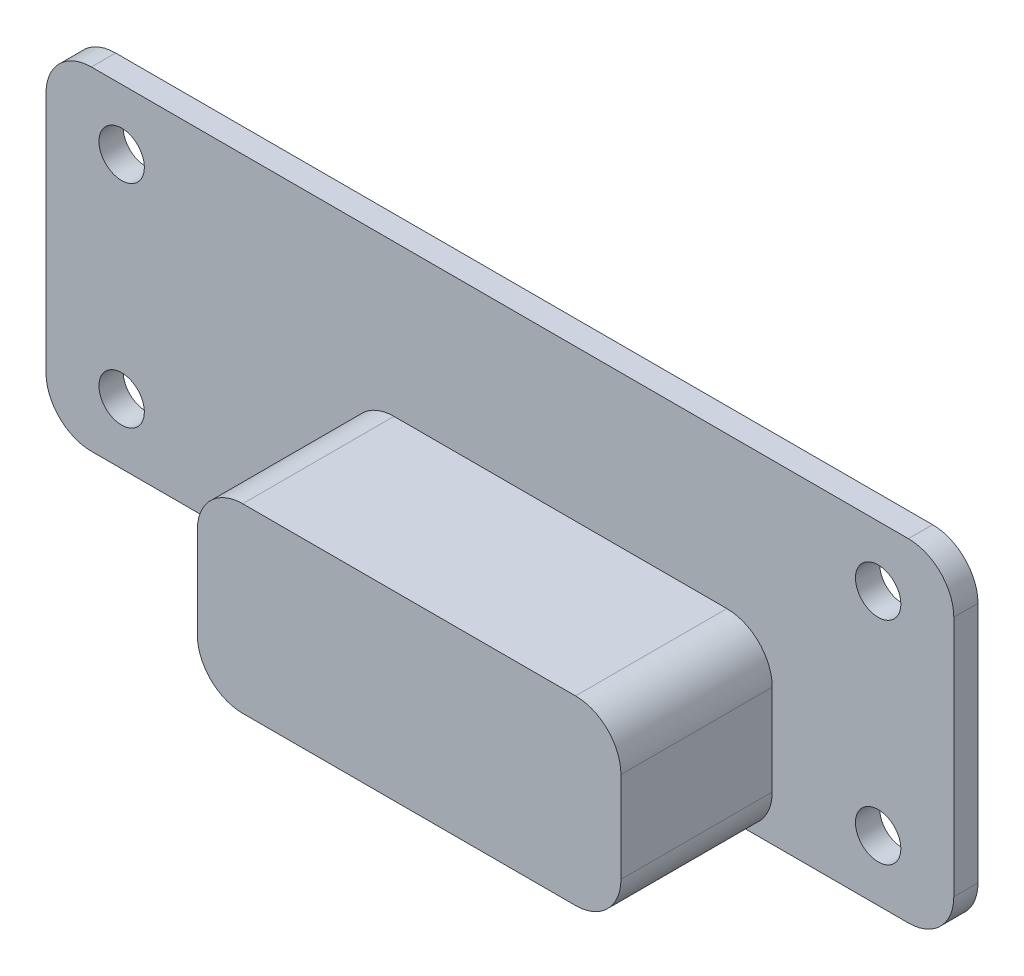
from build123d import *

# Parameters (mm, degrees)
SKETCH_1_R      = 1.5
EXTRUDE_1_DEPTH = 1.6
SKETCH_2_W      = 28
SKETCH_2_H      = 12
EXTRUDE_2_DEPTH = 10
FILLET_1_R      = 3


with BuildPart() as part:
    # 草图1 → 凸台-拉伸1 (new body)
    with BuildSketch(Plane.XY):
        with BuildLine():
            Line((-30, 8), (-30, -8))
            ThreePointArc((-30, -8), (-29.121320344, -10.121320344), (-27, -11))
            Line((-27, -11), (27, -11))
            ThreePointArc((27, -11), (29.121320344, -10.121320344), (30, -8))
            Line((30, -8), (30, 8))
            ThreePointArc((30, 8), (29.121320344, 10.121320344), (27, 11))
            Line((27, 11), (-27, 11))
            ThreePointArc((-27, 11), (-29.121320344, 10.121320344), (-30, 8))
        make_face()
        with Locations((-25, 7)):
            Circle(SKETCH_1_R, mode=Mode.SUBTRACT)
        with Locations((25, 7)):
            Circle(SKETCH_1_R, mode=Mode.SUBTRACT)
        with Locations((25, -7)):
            Circle(SKETCH_1_R, mode=Mode.SUBTRACT)
        with Locations((-25, -7)):
            Circle(SKETCH_1_R, mode=Mode.SUBTRACT)
    extrude(amount=EXTRUDE_1_DEPTH)

    # 草图2 → 凸台-拉伸2 (add)
    with BuildSketch(Plane.XY.offset(1.6)):
        with Locations((4, -5)):
            Rectangle(SKETCH_2_W, SKETCH_2_H)
    extrude(amount=EXTRUDE_2_DEPTH)

    # 圆角1
    fillet_1_edges = [part.edges().sort_by_distance(p)[0] for p in [
        (18, -11, 6.6),
        (18, 1, 6.6),
        (-10, -11, 6.6),
        (-10, 1, 6.6),
    ]]
    fillet(fillet_1_edges, radius=FILLET_1_R)


solid = part.part
